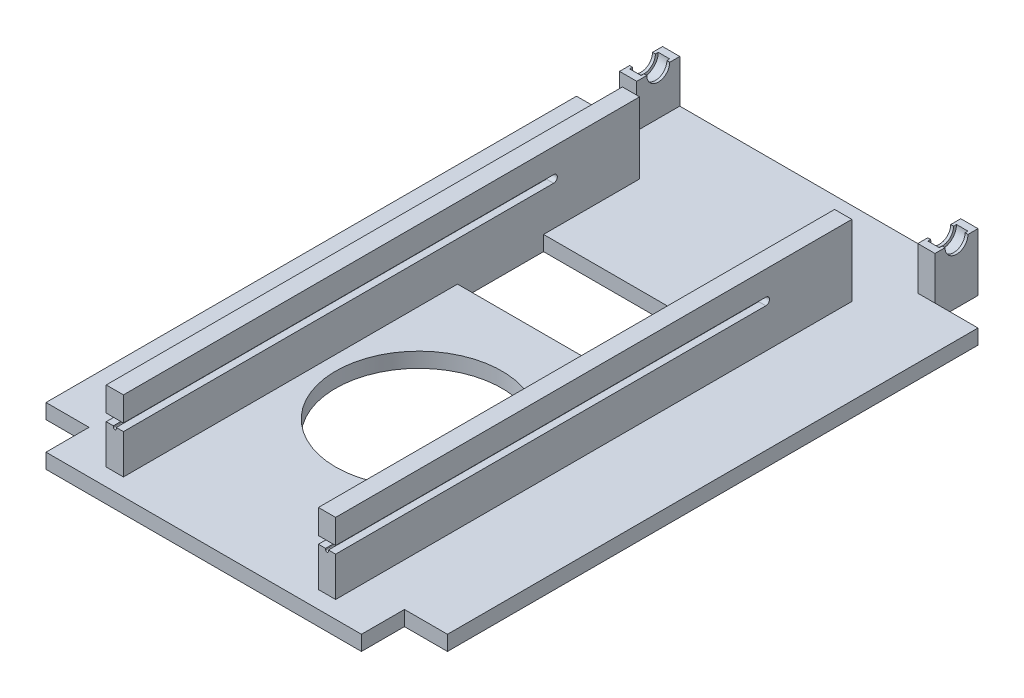
from build123d import *

# Parameters (mm, degrees)
BOSS_EXTRUDE1_DEPTH = 5.2
SKETCH2_R           = 29
CUT_EXTRUDE1_DEPTH  = 5.2
SKETCH5_W           = 6
SKETCH5_H           = 15
BOSS_EXTRUDE3_DEPTH = 15
SKETCH8_R           = 5
CUT_EXTRUDE3_DEPTH  = 2
SKETCH9_R           = 4
CUT_EXTRUDE4_DEPTH  = 167.100240819
BOSS_EXTRUDE2_DEPTH = 24.8
CUT_EXTRUDE2_DEPTH  = 157.704339442
SKETCH15_W          = 68
SKETCH15_H          = 30
CUT_EXTRUDE5_DEPTH  = 10


with BuildPart() as part:
    # Sketch1 → Boss-Extrude1 (new body)
    with BuildSketch(Plane(origin=(0, 0, 0), x_dir=(1, 0, 0), z_dir=(0, 1, 0))):
        Polygon((-55, -107.5), (55, -107.5), (55, -92.5), (70, -92.5), (70, 92.5), (55, 92.5), (55, 107.5), (-55, 107.5), (-55, 92.5), (-70, 92.5), (-70, -92.5), (-55, -92.5), align=None)
    extrude(amount=BOSS_EXTRUDE1_DEPTH)

    # Sketch2 → Cut-Extrude1 (cut)
    with BuildSketch(Plane(origin=(0, 5.2, 0), x_dir=(1, 0, 0), z_dir=(0, 1, 0))):
        with Locations((0, -32.5)):
            Circle(SKETCH2_R)
    extrude(amount=-CUT_EXTRUDE1_DEPTH, mode=Mode.SUBTRACT)

    # Sketch5 → Boss-Extrude3 (add)
    with BuildSketch(Plane(origin=(0, 5.2, 0), x_dir=(1, 0, 0), z_dir=(0, 1, 0))):
        with Locations((52, 100)):
            Rectangle(SKETCH5_W, SKETCH5_H)
        with Locations((-52, 100)):
            Rectangle(SKETCH5_W, SKETCH5_H)
    extrude(amount=BOSS_EXTRUDE3_DEPTH)

    # Sketch8 → Cut-Extrude3 (cut, symmetric)
    with BuildSketch(Plane.ZY.offset(52)):
        with Locations((-100, 20.2)):
            Circle(SKETCH8_R)
    cut_extrude3 = extrude(amount=CUT_EXTRUDE3_DEPTH, both=True, mode=Mode.SUBTRACT)

    # Mirror1: Cut-Extrude3 across plane
    add(cut_extrude3.mirror(Plane.ZY), mode=Mode.SUBTRACT)

    # Sketch9 → Cut-Extrude4 (cut, through all)
    with BuildSketch(Plane.ZY.offset(55)):
        with Locations((-100, 20.2)):
            Circle(SKETCH9_R)
    extrude(amount=-CUT_EXTRUDE4_DEPTH, mode=Mode.SUBTRACT)

    # Sketch3 → Boss-Extrude2 (add)
    with BuildSketch(Plane(origin=(0, 5.2, 0), x_dir=(1, 0, 0), z_dir=(0, 1, 0))):
        Polygon((-34, -32.5), (-34, -101.5), (-40, -101.5), (-40, 78.5), (-34, 78.5), align=None)
        Polygon((40, 78.5), (34, 78.5), (34, -32.5), (34, -101.5), (40, -101.5), align=None)
    extrude(amount=BOSS_EXTRUDE2_DEPTH)

    # Sketch4 → Cut-Extrude2 (cut, through all)
    with BuildSketch(Plane(origin=(40, 0, 0), x_dir=(0, 0, -1), z_dir=(1, 0, 0))):
        with BuildLine():
            Line((-101.5, 21.5), (48.5, 21.5))
            ThreePointArc((48.5, 21.5), (49.8, 20.2), (48.5, 18.9))
            Line((48.5, 18.9), (-101.5, 18.9))
            ThreePointArc((-101.5, 18.9), (-102.8, 20.2), (-101.5, 21.5))
        make_face()
    extrude(amount=-CUT_EXTRUDE2_DEPTH, mode=Mode.SUBTRACT)

    # Cut-Sweep4: sweep along a curve in space
    with BuildLine() as cut_sweep4_path:
        Line((40, 18.9, 101.5), (40, 18.9, -48.5))
    # Sketch10 → Cut-Sweep4 (sweep, cut)
    with BuildSketch(Plane.XY.offset(101.5)):
        with BuildLine():
            Line((36.5, 18.5), (36.5, 18.9))
            Line((36.5, 18.9), (37.5, 18.9))
            Line((37.5, 18.9), (37.5, 18.5))
            ThreePointArc((37.5, 18.5), (37, 18), (36.5, 18.5))
        make_face()
    cut_sweep4 = sweep(path=cut_sweep4_path.line, mode=Mode.SUBTRACT)

    # Mirror2: Cut-Sweep4 across plane
    add(cut_sweep4.mirror(Plane.ZY), mode=Mode.SUBTRACT)

    # Sketch15 → Cut-Extrude5 (cut)
    with BuildSketch(Plane(origin=(0, 5.2, 0), x_dir=(1, 0, 0), z_dir=(0, 1, 0))):
        with Locations((0, 30)):
            Rectangle(SKETCH15_W, SKETCH15_H)
    extrude(amount=-CUT_EXTRUDE5_DEPTH, mode=Mode.SUBTRACT)


solid = part.part
